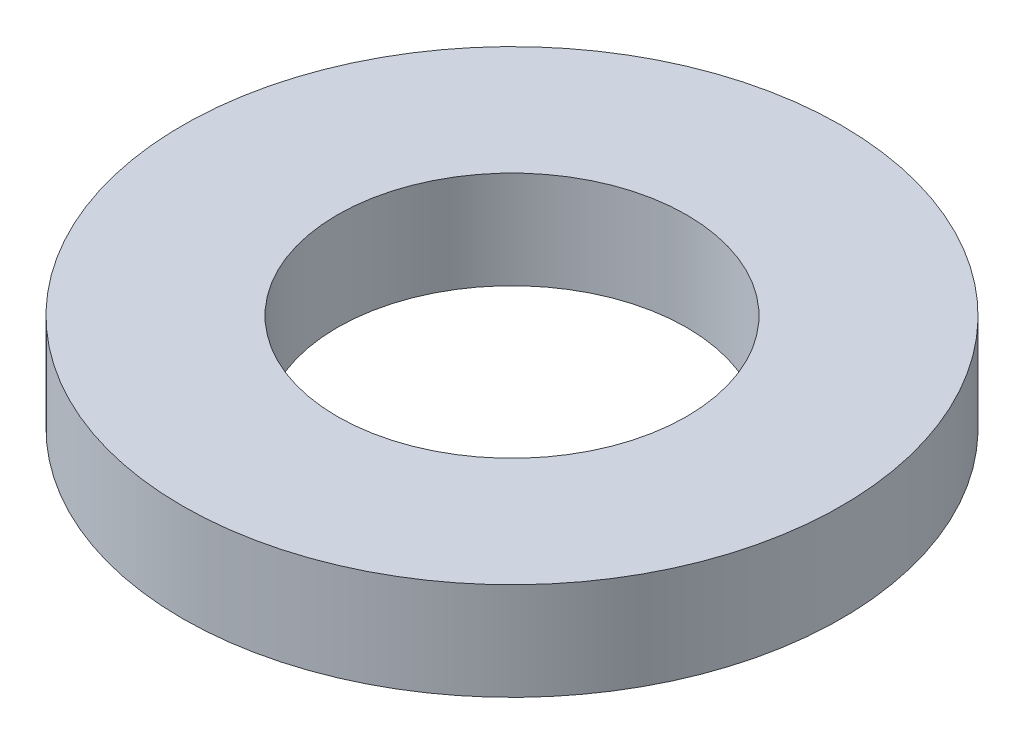
from build123d import *

# Parameters (mm, degrees)
SKETCH1_R           = 6.35
BOSS_EXTRUDE1_DEPTH = 1.8796
SKETCH5_R           = 3.3655
CUT_EXTRUDE1_DEPTH  = 10.174851288


with BuildPart() as part:
    # Sketch1 → Boss-Extrude1 (new body)
    with BuildSketch(Plane(origin=(0, 0, 0), x_dir=(1, 0, 0), z_dir=(0, 1, 0))):
        Circle(SKETCH1_R)
    extrude(amount=BOSS_EXTRUDE1_DEPTH)

    # Sketch5 → Cut-Extrude1 (cut, through all)
    with BuildSketch(Plane(origin=(0, 1.8796, 0), x_dir=(-1, 0, 0), z_dir=(0, 1, 0))):
        Circle(SKETCH5_R)
    extrude(amount=-CUT_EXTRUDE1_DEPTH, mode=Mode.SUBTRACT)


solid = part.part
